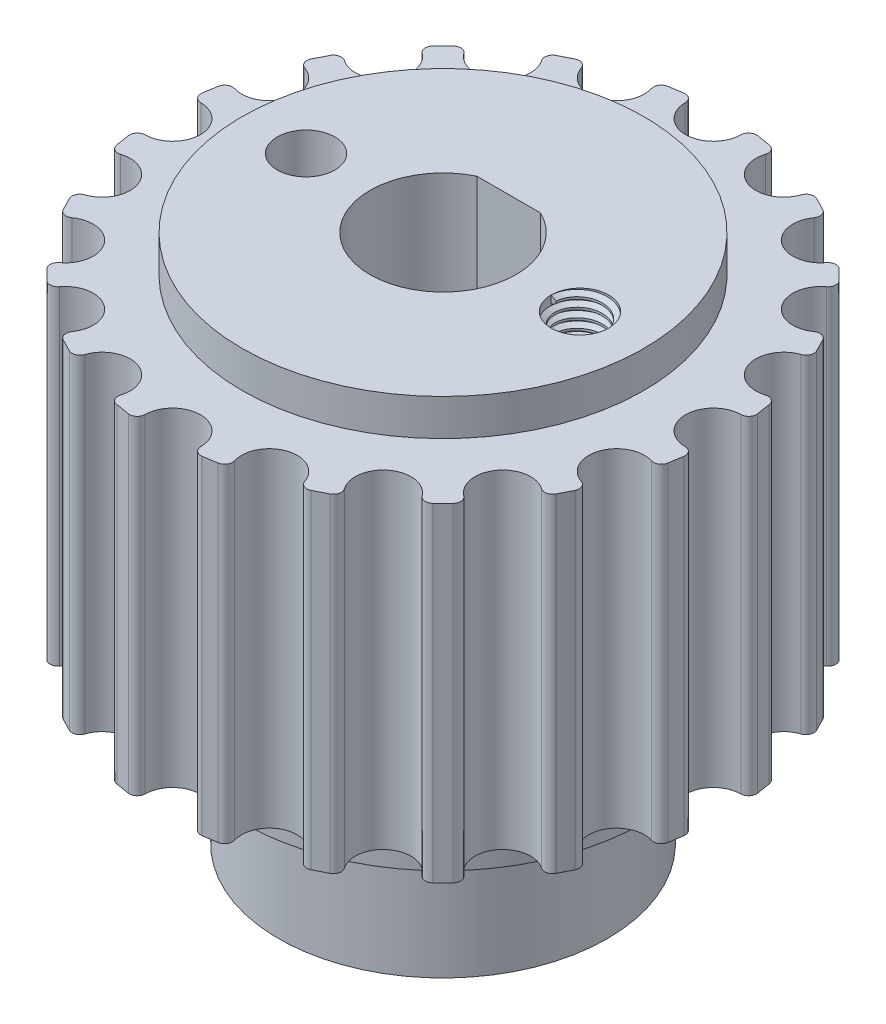
from build123d import *

# Parameters (mm, degrees)
AUFSATZ_LINEAR_AUSTRAGEN1_DEPTH           = 18
SKIZZE8_R                                 = 11
AUFSATZ_LINEAR_AUSTRAGEN3_DEPTH           = 2
SCHNITT_LINEAR_AUSTRAGEN3_DEPTH           = 35.526422048
SCHNITT_LINEAR_AUSTRAGEN3_DEPTH_BACK      = 35.526422048
GEWINDEBOHRUNG_F_R_M3X0_5_HELICOIL1_D     = 3.15
GEWINDEBOHRUNG_F_R_M3X0_5_HELICOIL1_DEPTH = 6.553644525
GEWINDEBOHRUNG_F_R_M3X0_5_HELICOIL1_TIP   = 0.946355475
GEWINDE1_PITCH                            = 0.5


with BuildPart() as part:
    # Skizze1 → Aufsatz-Linear austragen1 (new body)
    with BuildSketch(Plane(origin=(0, 0, 0), x_dir=(1, 0, 0), z_dir=(0, 1, 0))):
        with BuildLine():
            Line((2.777316931, 15.091432049), (2.022123607, 15.211042921))
            ThreePointArc((2.022123607, 15.211042921), (1.677578106, 15.114995622), (1.524888287, 14.791541599))
            ThreePointArc((1.524888287, 14.791541599), (1.071791943, 13.725155757), (0, 13.285))
            ThreePointArc((0, 13.285), (-1.071791943, 13.725155757), (-1.524888287, 14.791541599))
            ThreePointArc((-1.524888287, 14.791541599), (-1.677578106, 15.114995622), (-2.022123607, 15.211042921))
            Line((-2.022123607, 15.211042921), (-2.777316931, 15.091432049))
            ThreePointArc((-2.777316931, 15.091432049), (-3.075318928, 14.893615224), (-3.120582785, 14.538808418))
            ThreePointArc((-3.120582785, 14.538808418), (-3.221971668, 13.384600745), (-4.10529077, 12.634785819))
            ThreePointArc((-4.10529077, 12.634785819), (-5.260641091, 12.722196895), (-6.021092669, 13.596375628))
            ThreePointArc((-6.021092669, 13.596375628), (-6.266262106, 13.856814936), (-6.623624598, 13.84169093))
            Line((-6.623624598, 13.84169093), (-7.304894338, 13.49456666))
            ThreePointArc((-7.304894338, 13.49456666), (-7.527182318, 13.214343998), (-7.460589472, 12.862915373))
            ThreePointArc((-7.460589472, 12.862915373), (-7.200346243, 11.733867756), (-7.808727077, 10.74779077))
            ThreePointArc((-7.808727077, 10.74779077), (-8.934542036, 10.47390076), (-9.927910549, 11.07030168))
            ThreePointArc((-9.927910549, 11.07030168), (-10.241560712, 11.242232658), (-10.576759064, 11.11741779))
            Line((-10.576759064, 11.11741779), (-11.11741779, 10.576759064))
            ThreePointArc((-11.11741779, 10.576759064), (-11.242232658, 10.241560712), (-11.07030168, 9.927910549))
            ThreePointArc((-11.07030168, 9.927910549), (-10.47390076, 8.934542036), (-10.74779077, 7.808727077))
            ThreePointArc((-10.74779077, 7.808727077), (-11.733867756, 7.200346243), (-12.862915373, 7.460589472))
            ThreePointArc((-12.862915373, 7.460589472), (-13.214343998, 7.527182318), (-13.49456666, 7.304894338))
            Line((-13.49456666, 7.304894338), (-13.84169093, 6.623624598))
            ThreePointArc((-13.84169093, 6.623624598), (-13.856814936, 6.266262106), (-13.596375628, 6.021092669))
            ThreePointArc((-13.596375628, 6.021092669), (-12.722196895, 5.260641091), (-12.634785819, 4.10529077))
            ThreePointArc((-12.634785819, 4.10529077), (-13.384600745, 3.221971668), (-14.538808418, 3.120582785))
            ThreePointArc((-14.538808418, 3.120582785), (-14.893615224, 3.075318928), (-15.091432049, 2.777316931))
            Line((-15.091432049, 2.777316931), (-15.211042921, 2.022123607))
            ThreePointArc((-15.211042921, 2.022123607), (-15.114995622, 1.677578106), (-14.791541599, 1.524888287))
            ThreePointArc((-14.791541599, 1.524888287), (-13.725155757, 1.071791943), (-13.285, 0))
            ThreePointArc((-13.285, 0), (-13.725155757, -1.071791943), (-14.791541599, -1.524888287))
            ThreePointArc((-14.791541599, -1.524888287), (-15.114995622, -1.677578106), (-15.211042921, -2.022123607))
            Line((-15.211042921, -2.022123607), (-15.091432049, -2.777316931))
            ThreePointArc((-15.091432049, -2.777316931), (-14.893615224, -3.075318928), (-14.538808418, -3.120582785))
            ThreePointArc((-14.538808418, -3.120582785), (-13.384600745, -3.221971668), (-12.634785819, -4.10529077))
            ThreePointArc((-12.634785819, -4.10529077), (-12.722196895, -5.260641091), (-13.596375628, -6.021092669))
            ThreePointArc((-13.596375628, -6.021092669), (-13.856814936, -6.266262106), (-13.84169093, -6.623624598))
            Line((-13.84169093, -6.623624598), (-13.49456666, -7.304894338))
            ThreePointArc((-13.49456666, -7.304894338), (-13.214343998, -7.527182318), (-12.862915373, -7.460589472))
            ThreePointArc((-12.862915373, -7.460589472), (-11.733867756, -7.200346243), (-10.74779077, -7.808727077))
            ThreePointArc((-10.74779077, -7.808727077), (-10.47390076, -8.934542036), (-11.07030168, -9.927910549))
            ThreePointArc((-11.07030168, -9.927910549), (-11.242232658, -10.241560712), (-11.11741779, -10.576759064))
            Line((-11.11741779, -10.576759064), (-10.576759064, -11.11741779))
            ThreePointArc((-10.576759064, -11.11741779), (-10.241560712, -11.242232658), (-9.927910549, -11.07030168))
            ThreePointArc((-9.927910549, -11.07030168), (-8.934542036, -10.47390076), (-7.808727077, -10.74779077))
            ThreePointArc((-7.808727077, -10.74779077), (-7.200346243, -11.733867756), (-7.460589472, -12.862915373))
            ThreePointArc((-7.460589472, -12.862915373), (-7.527182318, -13.214343998), (-7.304894338, -13.49456666))
            Line((-7.304894338, -13.49456666), (-6.623624598, -13.84169093))
            ThreePointArc((-6.623624598, -13.84169093), (-6.266262106, -13.856814936), (-6.021092669, -13.596375628))
            ThreePointArc((-6.021092669, -13.596375628), (-5.260641091, -12.722196895), (-4.10529077, -12.634785819))
            ThreePointArc((-4.10529077, -12.634785819), (-3.221971668, -13.384600745), (-3.120582785, -14.538808418))
            ThreePointArc((-3.120582785, -14.538808418), (-3.075318928, -14.893615224), (-2.777316931, -15.091432049))
            Line((-2.777316931, -15.091432049), (-2.022123607, -15.211042921))
            ThreePointArc((-2.022123607, -15.211042921), (-1.677578106, -15.114995622), (-1.524888287, -14.791541599))
            ThreePointArc((-1.524888287, -14.791541599), (-1.071791943, -13.725155757), (0, -13.285))
            ThreePointArc((0, -13.285), (1.071791943, -13.725155757), (1.524888287, -14.791541599))
            ThreePointArc((1.524888287, -14.791541599), (1.677578106, -15.114995622), (2.022123607, -15.211042921))
            Line((2.022123607, -15.211042921), (2.777316931, -15.091432049))
            ThreePointArc((2.777316931, -15.091432049), (3.075318928, -14.893615224), (3.120582785, -14.538808418))
            ThreePointArc((3.120582785, -14.538808418), (3.221971668, -13.384600745), (4.10529077, -12.634785819))
            ThreePointArc((4.10529077, -12.634785819), (5.260641091, -12.722196895), (6.021092669, -13.596375628))
            ThreePointArc((6.021092669, -13.596375628), (6.266262106, -13.856814936), (6.623624598, -13.84169093))
            Line((6.623624598, -13.84169093), (7.304894338, -13.49456666))
            ThreePointArc((7.304894338, -13.49456666), (7.527182318, -13.214343998), (7.460589472, -12.862915373))
            ThreePointArc((7.460589472, -12.862915373), (7.200346243, -11.733867756), (7.808727077, -10.74779077))
            ThreePointArc((7.808727077, -10.74779077), (8.934542036, -10.47390076), (9.927910549, -11.07030168))
            ThreePointArc((9.927910549, -11.07030168), (10.241560712, -11.242232658), (10.576759064, -11.11741779))
            Line((10.576759064, -11.11741779), (11.11741779, -10.576759064))
            ThreePointArc((11.11741779, -10.576759064), (11.242232658, -10.241560712), (11.07030168, -9.927910549))
            ThreePointArc((11.07030168, -9.927910549), (10.47390076, -8.934542036), (10.74779077, -7.808727077))
            ThreePointArc((10.74779077, -7.808727077), (11.733867756, -7.200346243), (12.862915373, -7.460589472))
            ThreePointArc((12.862915373, -7.460589472), (13.214343998, -7.527182318), (13.49456666, -7.304894338))
            Line((13.49456666, -7.304894338), (13.84169093, -6.623624598))
            ThreePointArc((13.84169093, -6.623624598), (13.856814936, -6.266262106), (13.596375628, -6.021092669))
            ThreePointArc((13.596375628, -6.021092669), (12.722196895, -5.260641091), (12.634785819, -4.10529077))
            ThreePointArc((12.634785819, -4.10529077), (13.384600745, -3.221971668), (14.538808418, -3.120582785))
            ThreePointArc((14.538808418, -3.120582785), (14.893615224, -3.075318928), (15.091432049, -2.777316931))
            Line((15.091432049, -2.777316931), (15.211042921, -2.022123607))
            ThreePointArc((15.211042921, -2.022123607), (15.114995622, -1.677578106), (14.791541599, -1.524888287))
            ThreePointArc((14.791541599, -1.524888287), (13.725155757, -1.071791943), (13.285, 0))
            ThreePointArc((13.285, 0), (13.725155757, 1.071791943), (14.791541599, 1.524888287))
            ThreePointArc((14.791541599, 1.524888287), (15.114995622, 1.677578106), (15.211042921, 2.022123607))
            Line((15.211042921, 2.022123607), (15.091432049, 2.777316931))
            ThreePointArc((15.091432049, 2.777316931), (14.893615224, 3.075318928), (14.538808418, 3.120582785))
            ThreePointArc((14.538808418, 3.120582785), (13.384600745, 3.221971668), (12.634785819, 4.10529077))
            ThreePointArc((12.634785819, 4.10529077), (12.722196895, 5.260641091), (13.596375628, 6.021092669))
            ThreePointArc((13.596375628, 6.021092669), (13.856814936, 6.266262106), (13.84169093, 6.623624598))
            Line((13.84169093, 6.623624598), (13.49456666, 7.304894338))
            ThreePointArc((13.49456666, 7.304894338), (13.214343998, 7.527182318), (12.862915373, 7.460589472))
            ThreePointArc((12.862915373, 7.460589472), (11.733867756, 7.200346243), (10.74779077, 7.808727077))
            ThreePointArc((10.74779077, 7.808727077), (10.47390076, 8.934542036), (11.07030168, 9.927910549))
            ThreePointArc((11.07030168, 9.927910549), (11.242232658, 10.241560712), (11.11741779, 10.576759064))
            Line((11.11741779, 10.576759064), (10.576759064, 11.11741779))
            ThreePointArc((10.576759064, 11.11741779), (10.241560712, 11.242232658), (9.927910549, 11.07030168))
            ThreePointArc((9.927910549, 11.07030168), (8.934542036, 10.47390076), (7.808727077, 10.74779077))
            ThreePointArc((7.808727077, 10.74779077), (7.200346243, 11.733867756), (7.460589472, 12.862915373))
            ThreePointArc((7.460589472, 12.862915373), (7.527182318, 13.214343998), (7.304894338, 13.49456666))
            Line((7.304894338, 13.49456666), (6.623624598, 13.84169093))
            ThreePointArc((6.623624598, 13.84169093), (6.266262106, 13.856814936), (6.021092669, 13.596375628))
            ThreePointArc((6.021092669, 13.596375628), (5.260641091, 12.722196895), (4.10529077, 12.634785819))
            ThreePointArc((4.10529077, 12.634785819), (3.221971668, 13.384600745), (3.120582785, 14.538808418))
            ThreePointArc((3.120582785, 14.538808418), (3.075318928, 14.893615224), (2.777316931, 15.091432049))
        make_face()
    extrude(amount=AUFSATZ_LINEAR_AUSTRAGEN1_DEPTH)

    # Skizze4 → Rotation1 (revolve)
    with BuildSketch(Plane.XY):
        Polygon((11, 0), (11, -2.5), (9, -2.5), (9, -9), (0, -9), (0, 0), align=None)
    revolve(axis=Axis((0, -1014, 0), (0, 1, 0)))

    # Skizze8 → Aufsatz-Linear austragen3 (add)
    with BuildSketch(Plane(origin=(0, 18, 0), x_dir=(1, 0, 0), z_dir=(0, 1, 0))):
        Circle(SKIZZE8_R)
    extrude(amount=AUFSATZ_LINEAR_AUSTRAGEN3_DEPTH)

    # Skizze7 → Schnitt-Linear austragen3 (cut, two sides: drawn at the far end of the back side and taken through both)
    with BuildSketch(Plane(origin=(0, 18, 0), x_dir=(1, 0, 0), z_dir=(0, 1, 0)).offset(-SCHNITT_LINEAR_AUSTRAGEN3_DEPTH_BACK)):
        with BuildLine():
            Line((-1.743559577, 3.6), (1.743559577, 3.6))
            ThreePointArc((1.743559577, 3.6), (0, -4), (-1.743559577, 3.6))
        make_face()
    extrude(amount=SCHNITT_LINEAR_AUSTRAGEN3_DEPTH + SCHNITT_LINEAR_AUSTRAGEN3_DEPTH_BACK, mode=Mode.SUBTRACT)

    # Gewindebohrung für M3x0.5 Helicoil1
    with Locations(Plane(origin=(0, 20, 0), x_dir=(1, 0, 0), z_dir=(0, 1, 0))):
        with Locations((7.5, 0), (-7.5, 0)):
            Hole(GEWINDEBOHRUNG_F_R_M3X0_5_HELICOIL1_D / 2, depth=GEWINDEBOHRUNG_F_R_M3X0_5_HELICOIL1_DEPTH)
            with Locations((0, 0, -(GEWINDEBOHRUNG_F_R_M3X0_5_HELICOIL1_DEPTH + GEWINDEBOHRUNG_F_R_M3X0_5_HELICOIL1_TIP / 2))):  # 118° drill point
                Cone(0, GEWINDEBOHRUNG_F_R_M3X0_5_HELICOIL1_D / 2, GEWINDEBOHRUNG_F_R_M3X0_5_HELICOIL1_TIP, mode=Mode.SUBTRACT)

    # Gewinde1: the profile of Gewindeprofil1 profile screwed along a right-hand helix of 20 turns, 6 arcs to a turn; built about Z, then put on its axis
    gewinde1_z = Axis((0, 0, 0), (0, 0, 1))
    gewinde1_corners = [(1.5753, 0, -0.000173205), (1.5753, 0, 0.437673204), (1.304367062, 0, 0.281249999), (1.304367062, 0, 0.156249999)]
    with BuildLine(mode=Mode.PRIVATE) as gewinde1_profile:
        Line(gewinde1_corners[0], gewinde1_corners[1])
        Line(gewinde1_corners[1], gewinde1_corners[2])
        Line(gewinde1_corners[2], gewinde1_corners[3])
        Line(gewinde1_corners[3], gewinde1_corners[0])
    gewinde1_cap = Face(gewinde1_profile.wire())
    gewinde1_turn_angles = [0, 30, 60, 90, 120, 150, 180, 210, 240, 270, 300, 330, 360]
    gewinde1_turn_weights = [1, 0.8660254037844387, 1, 0.8660254037844387, 1, 0.8660254037844387, 1, 0.8660254037844387, 1, 0.8660254037844387, 1, 0.8660254037844387, 1]
    gewinde1_turn_rails = [Edge.make_bspline([Vector(p[0], p[1], 0).rotate(gewinde1_z, gewinde1_turn_angles[k]) / gewinde1_turn_weights[k] + Vector(0, 0, p[2] + GEWINDE1_PITCH * gewinde1_turn_angles[k] / 360) for k in range(13)], [0, 0, 0, 1, 1, 2, 2, 3, 3, 4, 4, 5, 5, 6, 6, 6], 2, gewinde1_turn_weights) for p in gewinde1_corners]
    gewinde1_turn_sides = [Face.make_surface_from_curves(gewinde1_turn_rails[p[0]], gewinde1_turn_rails[p[1]]) for p in [(0, 1), (1, 2), (2, 3), (3, 0)]]
    gewinde1 = Plane(origin=(7.5, 20, 0), x_dir=(-1, 0, 0), z_dir=(0, -1, 0)) * Solid(Shell([*[p.moved(Location((0, 0, GEWINDE1_PITCH * i))) for i in range(20) for p in gewinde1_turn_sides], gewinde1_cap, gewinde1_cap.rotate(gewinde1_z, 7200).moved(Location((0, 0, GEWINDE1_PITCH * 7200 / 360)))]))
    add(gewinde1)


solid = part.part
